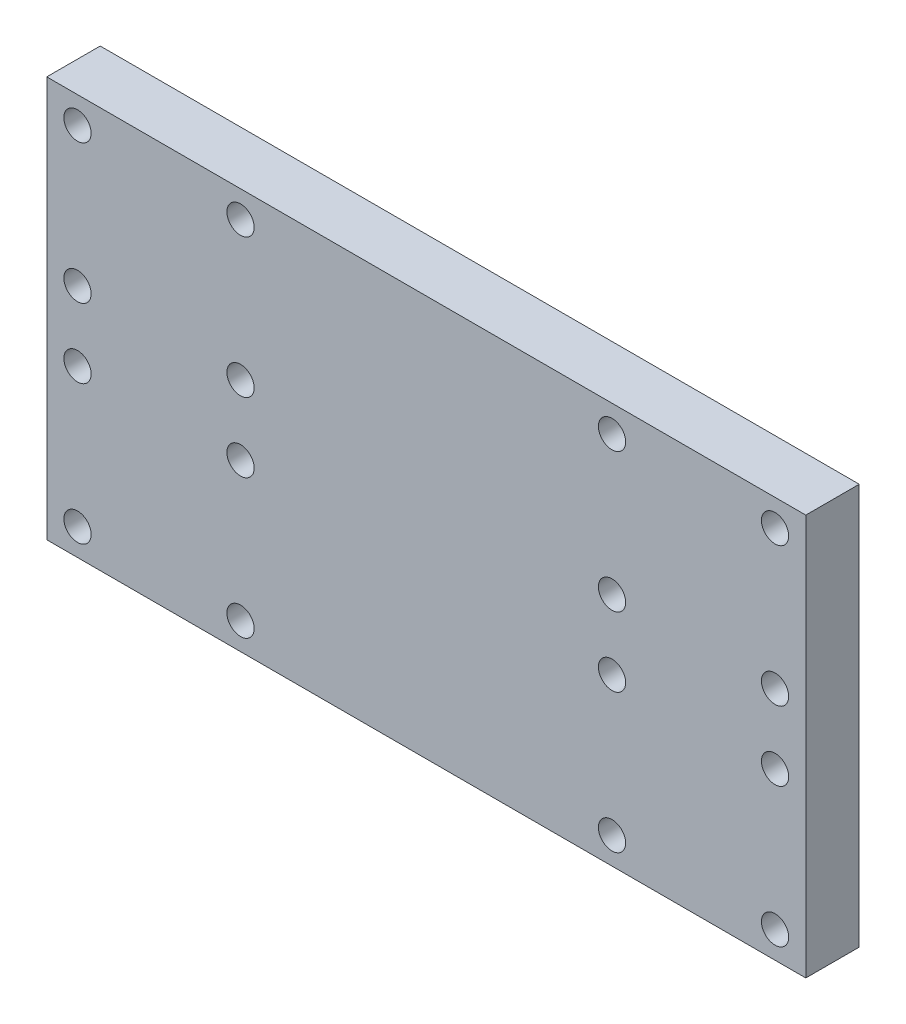
from build123d import *

# Parameters (mm, degrees)
SKETCH1_W           = 142
SKETCH1_H           = 75
BOSS_EXTRUDE1_DEPTH = 5
SKETCH2_R           = 2.55
CUT_EXTRUDE1_DEPTH  = 81.915078941


with BuildPart() as part:
    # Sketch1 → Boss-Extrude1 (new, symmetric)
    with BuildSketch(Plane.XY):
        Rectangle(SKETCH1_W, SKETCH1_H)
    extrude(amount=BOSS_EXTRUDE1_DEPTH, both=True)

    # Sketch2 → Cut-Extrude1 (cut, through all)
    with BuildSketch(Plane.XY.offset(5)):
        with Locations((-65.25, 32.5)):
            Circle(SKETCH2_R)
        with Locations((-34.75, 32.5)):
            Circle(SKETCH2_R)
        with Locations((-34.75, 6.5)):
            Circle(SKETCH2_R)
        with Locations((-65.25, 6.5)):
            Circle(SKETCH2_R)
        with Locations((65.25, 32.5)):
            Circle(SKETCH2_R)
        with Locations((65.25, 6.5)):
            Circle(SKETCH2_R)
        with Locations((34.75, 6.5)):
            Circle(SKETCH2_R)
        with Locations((34.75, 32.5)):
            Circle(SKETCH2_R)
        with Locations((-65.25, -6.5)):
            Circle(SKETCH2_R)
        with Locations((-34.75, -6.5)):
            Circle(SKETCH2_R)
        with Locations((-34.75, -32.5)):
            Circle(SKETCH2_R)
        with Locations((-65.25, -32.5)):
            Circle(SKETCH2_R)
        with Locations((34.75, -6.5)):
            Circle(SKETCH2_R)
        with Locations((65.25, -6.5)):
            Circle(SKETCH2_R)
        with Locations((65.25, -32.5)):
            Circle(SKETCH2_R)
        with Locations((34.75, -32.5)):
            Circle(SKETCH2_R)
    extrude(amount=-CUT_EXTRUDE1_DEPTH, mode=Mode.SUBTRACT)


solid = part.part
